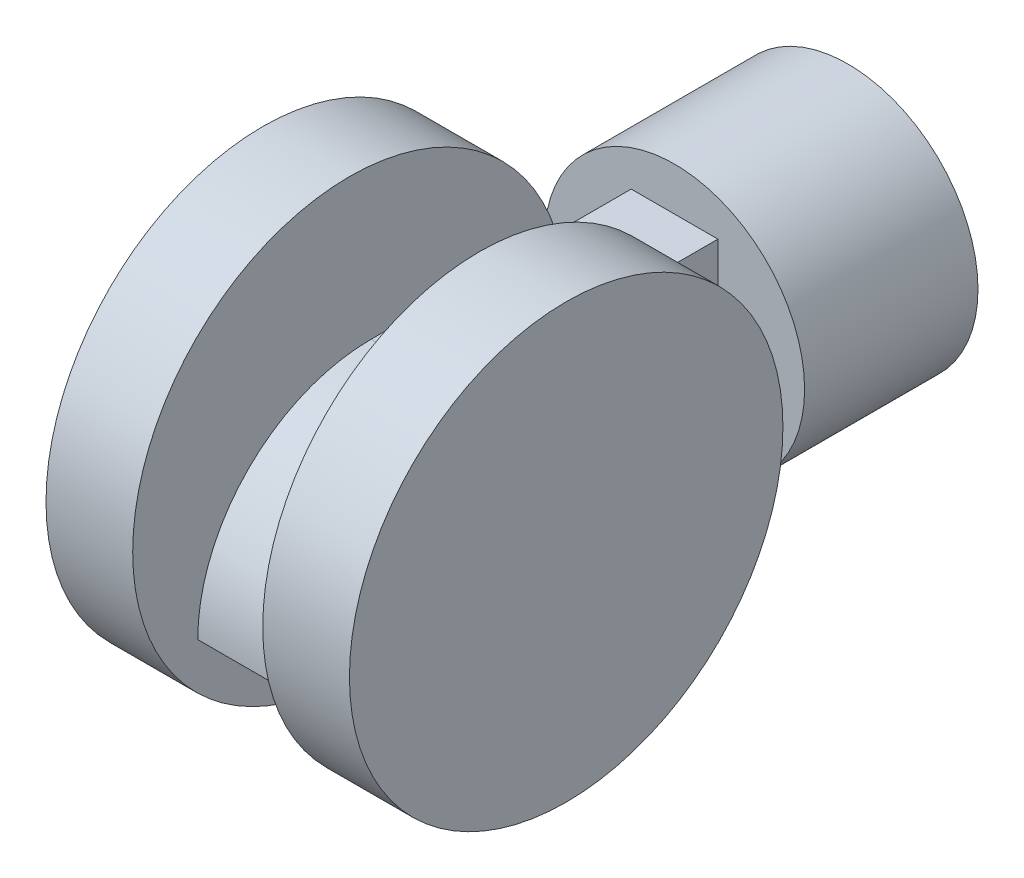
from build123d import *

# Parameters (mm, degrees)
SKETCH_1_R      = 3
EXTRUDE_1_DEPTH = 4
EXTRUDE_2_DEPTH = 14
SKETCH_4_R      = 1
EXTRUDE_3_DEPTH = 1.5
SKETCH_5_R      = 5
EXTRUDE_4_DEPTH = 2
EXTRUDE_START   = 2
SKETCH_6_R      = 5
EXTRUDE_5_DEPTH = 2
FILLET_1_R      = 4


with BuildPart() as part:
    # 草图1 → 凸台-拉伸1 (new body)
    with BuildSketch(Plane.XY):
        Circle(SKETCH_1_R)
    extrude(amount=EXTRUDE_1_DEPTH)

    # 草图2 → 凸台-拉伸2 (add)
    with BuildSketch(Plane.XY):
        Polygon((1, 0), (1, 2), (-1, 2), (-1, -2), (1, -2), align=None)
    extrude(amount=EXTRUDE_2_DEPTH)

    # 草图4 → 凸台-拉伸3 (add, symmetric)
    with BuildSketch(Plane(origin=(0, 0, 0), x_dir=(0, 0, -1), z_dir=(1, 0, 0))):
        with Locations(Location((-10, 0, 0), (0, 0, 90))):
            Circle(SKETCH_4_R)
    extrude(amount=EXTRUDE_3_DEPTH, both=True)

    # 草图5 → 凸台-拉伸4 (add)
    with BuildSketch(Plane.ZY.offset(1.5)):
        with Locations((10, 0)):
            Circle(SKETCH_5_R)
    extrude(amount=EXTRUDE_4_DEPTH)

    # 草图6 → 凸台-拉伸5 (add)
    with BuildSketch(Plane(origin=(1.5, 0, 0), x_dir=(0, 0, -1), z_dir=(1, 0, 0)).offset(EXTRUDE_START)):
        with Locations(Location((-10, 0, 0), (0, 0, 180))):
            Circle(SKETCH_6_R)
    extrude(amount=-EXTRUDE_5_DEPTH)

    # 圆角1
    fillet_1_edges = [part.edges().sort_by_distance(p)[0] for p in [
        (0, 2, 14),
    ]]
    fillet(fillet_1_edges, radius=FILLET_1_R - 0.0001)  # a hair under: the kernel refuses the full size


solid = part.part
